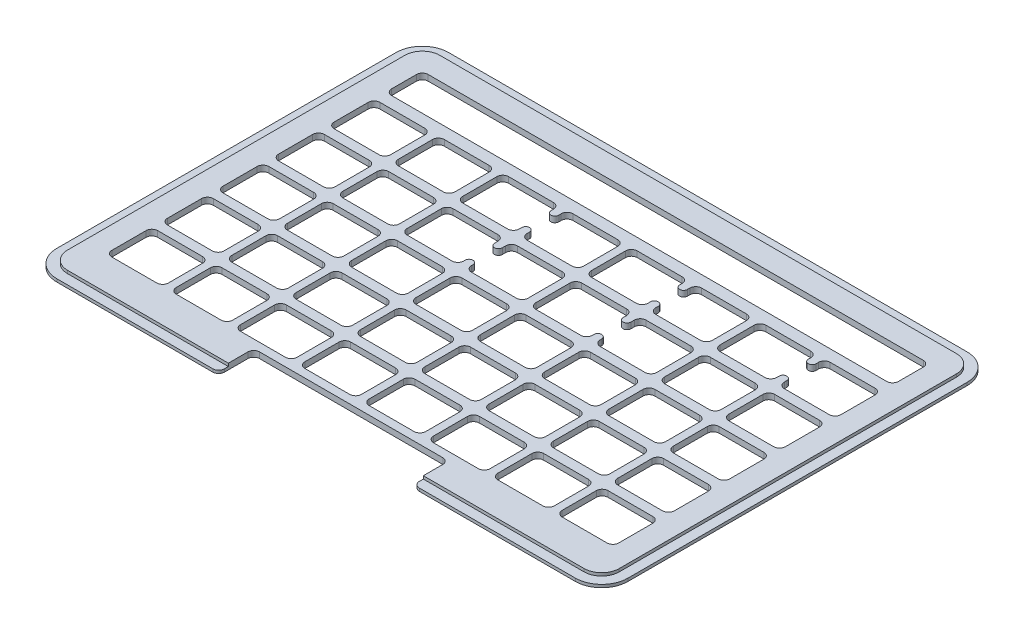
from build123d import *

# Parameters (mm, degrees)
SKETCH1_W                = 293
SKETCH1_H                = 201
OUTER_PROFILE_DEPTH      = 1.5
SKETCH2_W                = 283
SKETCH2_H                = 191
INNER_PROFILE_DEPTH      = 1.5
FILLET1_R                = 9
FILLET2_R                = 13.5
SKETCH3_W                = 29
SKETCH3_H                = 23.5
CUTOUT_DEPTH             = 178.683707751
CORNERS_R                = 3
CUTOUTS_COUNT            = 4
CUTOUTS_PITCH            = 33
CUTOUTS_COUNT_DIR2       = 5
CUTOUTS_PITCH_DIR2       = 28.5
CORNERS_OF_CUTOUTS_R     = 3
MIRROR1_DEPTH            = 3
SKETCH4_W                = 260
SKETCH4_H                = 18.75
MESSAGE_WINDOW_DEPTH     = 178.683707751
MESSAGE_WINDOW_CORNERS_R = 3
CELL_SPLIT_DEPTH         = 178.683707751
CELL_SPLITS_COUNT        = 3
CELL_SPLITS_PITCH        = 66
CELL_SPLITS_COUNT_DIR2   = 2
CELL_SPLITS_PITCH_DIR2   = 29
SKETCH6_W                = 100
SKETCH6_H                = 18
BASE_CUTBACK_DEPTH       = 178.683707751
FILLET5_R                = 3


# Read off the part's stored shape, not the designer's step: Mirror1
with BuildPart() as part:
    # Sketch1 → Outer Profile (new body)
    with BuildSketch(Plane(origin=(0, 0, 0), x_dir=(1, 0, 0), z_dir=(0, 1, 0))):
        Rectangle(SKETCH1_W, SKETCH1_H)
    extrude(amount=OUTER_PROFILE_DEPTH)

    # Sketch2 → Inner Profile (add)
    with BuildSketch(Plane(origin=(0, 1.5, 0), x_dir=(1, 0, 0), z_dir=(0, 1, 0))):
        Rectangle(SKETCH2_W, SKETCH2_H)
    extrude(amount=INNER_PROFILE_DEPTH)

    # Fillet1
    fillet1_edges = [part.edges().sort_by_distance(p)[0] for p in [
        (141.5, 2.25, 95.5),
        (141.5, 2.25, -95.5),
        (-141.5, 2.25, -95.5),
        (-141.5, 2.25, 95.5),
    ]]
    fillet(fillet1_edges, radius=FILLET1_R)

    # Fillet2
    fillet2_edges = [part.edges().sort_by_distance(p)[0] for p in [
        (146.5, 0.75, 100.5),
        (-146.5, 0.75, 100.5),
        (-146.5, 0.75, -100.5),
        (146.5, 0.75, -100.5),
    ]]
    fillet(fillet2_edges, radius=FILLET2_R)

    # Sketch3 → Cutout (cut, through all)
    with BuildSketch(Plane(origin=(0, 3, 0), x_dir=(1, 0, 0), z_dir=(0, 1, 0))):
        with Locations((-16.5, -66.5)):
            Rectangle(SKETCH3_W, SKETCH3_H)
    cutout = extrude(amount=-CUTOUT_DEPTH, mode=Mode.SUBTRACT)

    # Corners
    corners_edges = [part.edges().sort_by_distance(p)[0] for p in [
        (-2, 1.5, 54.75),
        (-2, 1.5, 78.25),
        (-31, 1.5, 78.25),
        (-31, 1.5, 54.75),
    ]]
    fillet(corners_edges, radius=CORNERS_R)

    # Cutouts: Cutout 4 × 5
    with Locations(*[(-i * CUTOUTS_PITCH, 0, -j * CUTOUTS_PITCH_DIR2) for i in range(CUTOUTS_COUNT) for j in range(CUTOUTS_COUNT_DIR2) if (i, j) != (0, 0)]):
        add(cutout, mode=Mode.SUBTRACT)

    # Corners of Cutouts
    corners_of_cutouts_edges = [part.edges().sort_by_distance(p)[0] for p in [
        (-2, 1.5, 26.25),
        (-2, 1.5, 49.75),
        (-31, 1.5, 49.75),
        (-31, 1.5, 26.25),
        (-2, 1.5, -2.25),
        (-2, 1.5, 21.25),
        (-31, 1.5, 21.25),
        (-31, 1.5, -2.25),
        (-2, 1.5, -30.75),
        (-2, 1.5, -7.25),
        (-31, 1.5, -7.25),
        (-31, 1.5, -30.75),
        (-2, 1.5, -59.25),
        (-2, 1.5, -35.75),
        (-31, 1.5, -35.75),
        (-31, 1.5, -59.25),
        (-35, 1.5, 54.75),
        (-35, 1.5, 78.25),
        (-64, 1.5, 78.25),
        (-64, 1.5, 54.75),
        (-35, 1.5, 26.25),
        (-35, 1.5, 49.75),
        (-64, 1.5, 49.75),
        (-64, 1.5, 26.25),
        (-35, 1.5, -2.25),
        (-35, 1.5, 21.25),
        (-64, 1.5, 21.25),
        (-64, 1.5, -2.25),
        (-35, 1.5, -30.75),
        (-35, 1.5, -7.25),
        (-64, 1.5, -7.25),
        (-64, 1.5, -30.75),
        (-35, 1.5, -59.25),
        (-35, 1.5, -35.75),
        (-64, 1.5, -35.75),
        (-64, 1.5, -59.25),
        (-68, 1.5, 54.75),
        (-68, 1.5, 78.25),
        (-97, 1.5, 78.25),
        (-97, 1.5, 54.75),
        (-68, 1.5, 26.25),
        (-68, 1.5, 49.75),
        (-97, 1.5, 49.75),
        (-97, 1.5, 26.25),
        (-68, 1.5, -2.25),
        (-68, 1.5, 21.25),
        (-97, 1.5, 21.25),
        (-97, 1.5, -2.25),
        (-68, 1.5, -30.75),
        (-68, 1.5, -7.25),
        (-97, 1.5, -7.25),
        (-97, 1.5, -30.75),
        (-68, 1.5, -59.25),
        (-68, 1.5, -35.75),
        (-97, 1.5, -35.75),
        (-97, 1.5, -59.25),
        (-101, 1.5, 54.75),
        (-101, 1.5, 78.25),
        (-130, 1.5, 78.25),
        (-130, 1.5, 54.75),
        (-101, 1.5, 26.25),
        (-101, 1.5, 49.75),
        (-130, 1.5, 49.75),
        (-130, 1.5, 26.25),
        (-101, 1.5, -2.25),
        (-101, 1.5, 21.25),
        (-130, 1.5, 21.25),
        (-130, 1.5, -2.25),
        (-101, 1.5, -30.75),
        (-101, 1.5, -7.25),
        (-130, 1.5, -7.25),
        (-130, 1.5, -30.75),
        (-101, 1.5, -59.25),
        (-101, 1.5, -35.75),
        (-130, 1.5, -35.75),
        (-130, 1.5, -59.25),
    ]]
    fillet(corners_of_cutouts_edges, radius=CORNERS_OF_CUTOUTS_R)

    # Mirror1 outline → Mirror1 (cut)
    with BuildSketch(Plane(origin=(0, 0, 0), x_dir=(1, 0, 0), z_dir=(0, 1, 0))):
        with BuildLine():
            Line((5, -78.25), (28, -78.25))
            ThreePointArc((28, -78.25), (30.121320344, -77.371320344), (31, -75.25))
            Line((31, -75.25), (31, -57.75))
            ThreePointArc((31, -57.75), (30.121320344, -55.628679656), (28, -54.75))
            Line((28, -54.75), (5, -54.75))
            ThreePointArc((5, -54.75), (2.878679656, -55.628679656), (2, -57.75))
            Line((2, -57.75), (2, -75.25))
            ThreePointArc((2, -75.25), (2.878679656, -77.371320344), (5, -78.25))
        make_face()
        with BuildLine():
            Line((38, -78.25), (61, -78.25))
            ThreePointArc((61, -78.25), (63.121320344, -77.371320344), (64, -75.25))
            Line((64, -75.25), (64, -57.75))
            ThreePointArc((64, -57.75), (63.121320344, -55.628679656), (61, -54.75))
            Line((61, -54.75), (38, -54.75))
            ThreePointArc((38, -54.75), (35.878679656, -55.628679656), (35, -57.75))
            Line((35, -57.75), (35, -75.25))
            ThreePointArc((35, -75.25), (35.878679656, -77.371320344), (38, -78.25))
        make_face()
        with BuildLine():
            Line((71, -78.25), (94, -78.25))
            ThreePointArc((94, -78.25), (96.121320344, -77.371320344), (97, -75.25))
            Line((97, -75.25), (97, -57.75))
            ThreePointArc((97, -57.75), (96.121320344, -55.628679656), (94, -54.75))
            Line((94, -54.75), (71, -54.75))
            ThreePointArc((71, -54.75), (68.878679656, -55.628679656), (68, -57.75))
            Line((68, -57.75), (68, -75.25))
            ThreePointArc((68, -75.25), (68.878679656, -77.371320344), (71, -78.25))
        make_face()
        with BuildLine():
            Line((104, -78.25), (127, -78.25))
            ThreePointArc((127, -78.25), (129.121320344, -77.371320344), (130, -75.25))
            Line((130, -75.25), (130, -57.75))
            ThreePointArc((130, -57.75), (129.121320344, -55.628679656), (127, -54.75))
            Line((127, -54.75), (104, -54.75))
            ThreePointArc((104, -54.75), (101.878679656, -55.628679656), (101, -57.75))
            Line((101, -57.75), (101, -75.25))
            ThreePointArc((101, -75.25), (101.878679656, -77.371320344), (104, -78.25))
        make_face()
        with BuildLine():
            Line((5, -49.75), (28, -49.75))
            ThreePointArc((28, -49.75), (30.121320344, -48.871320344), (31, -46.75))
            Line((31, -46.75), (31, -29.25))
            ThreePointArc((31, -29.25), (30.121320344, -27.128679656), (28, -26.25))
            Line((28, -26.25), (5, -26.25))
            ThreePointArc((5, -26.25), (2.878679656, -27.128679656), (2, -29.25))
            Line((2, -29.25), (2, -46.75))
            ThreePointArc((2, -46.75), (2.878679656, -48.871320344), (5, -49.75))
        make_face()
        with BuildLine():
            Line((38, -49.75), (61, -49.75))
            ThreePointArc((61, -49.75), (63.121320344, -48.871320344), (64, -46.75))
            Line((64, -46.75), (64, -29.25))
            ThreePointArc((64, -29.25), (63.121320344, -27.128679656), (61, -26.25))
            Line((61, -26.25), (38, -26.25))
            ThreePointArc((38, -26.25), (35.878679656, -27.128679656), (35, -29.25))
            Line((35, -29.25), (35, -46.75))
            ThreePointArc((35, -46.75), (35.878679656, -48.871320344), (38, -49.75))
        make_face()
        with BuildLine():
            Line((71, -49.75), (94, -49.75))
            ThreePointArc((94, -49.75), (96.121320344, -48.871320344), (97, -46.75))
            Line((97, -46.75), (97, -29.25))
            ThreePointArc((97, -29.25), (96.121320344, -27.128679656), (94, -26.25))
            Line((94, -26.25), (71, -26.25))
            ThreePointArc((71, -26.25), (68.878679656, -27.128679656), (68, -29.25))
            Line((68, -29.25), (68, -46.75))
            ThreePointArc((68, -46.75), (68.878679656, -48.871320344), (71, -49.75))
        make_face()
        with BuildLine():
            Line((104, -49.75), (127, -49.75))
            ThreePointArc((127, -49.75), (129.121320344, -48.871320344), (130, -46.75))
            Line((130, -46.75), (130, -29.25))
            ThreePointArc((130, -29.25), (129.121320344, -27.128679656), (127, -26.25))
            Line((127, -26.25), (104, -26.25))
            ThreePointArc((104, -26.25), (101.878679656, -27.128679656), (101, -29.25))
            Line((101, -29.25), (101, -46.75))
            ThreePointArc((101, -46.75), (101.878679656, -48.871320344), (104, -49.75))
        make_face()
        with BuildLine():
            Line((5, -21.25), (28, -21.25))
            ThreePointArc((28, -21.25), (30.121320344, -20.371320344), (31, -18.25))
            Line((31, -18.25), (31, -0.75))
            ThreePointArc((31, -0.75), (30.121320344, 1.371320344), (28, 2.25))
            Line((28, 2.25), (5, 2.25))
            ThreePointArc((5, 2.25), (2.878679656, 1.371320344), (2, -0.75))
            Line((2, -0.75), (2, -18.25))
            ThreePointArc((2, -18.25), (2.878679656, -20.371320344), (5, -21.25))
        make_face()
        with BuildLine():
            Line((38, -21.25), (61, -21.25))
            ThreePointArc((61, -21.25), (63.121320344, -20.371320344), (64, -18.25))
            Line((64, -18.25), (64, -0.75))
            ThreePointArc((64, -0.75), (63.121320344, 1.371320344), (61, 2.25))
            Line((61, 2.25), (38, 2.25))
            ThreePointArc((38, 2.25), (35.878679656, 1.371320344), (35, -0.75))
            Line((35, -0.75), (35, -18.25))
            ThreePointArc((35, -18.25), (35.878679656, -20.371320344), (38, -21.25))
        make_face()
        with BuildLine():
            Line((71, -21.25), (94, -21.25))
            ThreePointArc((94, -21.25), (96.121320344, -20.371320344), (97, -18.25))
            Line((97, -18.25), (97, -0.75))
            ThreePointArc((97, -0.75), (96.121320344, 1.371320344), (94, 2.25))
            Line((94, 2.25), (71, 2.25))
            ThreePointArc((71, 2.25), (68.878679656, 1.371320344), (68, -0.75))
            Line((68, -0.75), (68, -18.25))
            ThreePointArc((68, -18.25), (68.878679656, -20.371320344), (71, -21.25))
        make_face()
        with BuildLine():
            Line((104, -21.25), (127, -21.25))
            ThreePointArc((127, -21.25), (129.121320344, -20.371320344), (130, -18.25))
            Line((130, -18.25), (130, -0.75))
            ThreePointArc((130, -0.75), (129.121320344, 1.371320344), (127, 2.25))
            Line((127, 2.25), (104, 2.25))
            ThreePointArc((104, 2.25), (101.878679656, 1.371320344), (101, -0.75))
            Line((101, -0.75), (101, -18.25))
            ThreePointArc((101, -18.25), (101.878679656, -20.371320344), (104, -21.25))
        make_face()
        with BuildLine():
            Line((5, 7.25), (28, 7.25))
            ThreePointArc((28, 7.25), (30.121320344, 8.128679656), (31, 10.25))
            Line((31, 10.25), (31, 27.75))
            ThreePointArc((31, 27.75), (30.121320344, 29.871320344), (28, 30.75))
            Line((28, 30.75), (5, 30.75))
            ThreePointArc((5, 30.75), (2.878679656, 29.871320344), (2, 27.75))
            Line((2, 27.75), (2, 10.25))
            ThreePointArc((2, 10.25), (2.878679656, 8.128679656), (5, 7.25))
        make_face()
        with BuildLine():
            Line((38, 7.25), (61, 7.25))
            ThreePointArc((61, 7.25), (63.121320344, 8.128679656), (64, 10.25))
            Line((64, 10.25), (64, 27.75))
            ThreePointArc((64, 27.75), (63.121320344, 29.871320344), (61, 30.75))
            Line((61, 30.75), (38, 30.75))
            ThreePointArc((38, 30.75), (35.878679656, 29.871320344), (35, 27.75))
            Line((35, 27.75), (35, 10.25))
            ThreePointArc((35, 10.25), (35.878679656, 8.128679656), (38, 7.25))
        make_face()
        with BuildLine():
            Line((71, 7.25), (94, 7.25))
            ThreePointArc((94, 7.25), (96.121320344, 8.128679656), (97, 10.25))
            Line((97, 10.25), (97, 27.75))
            ThreePointArc((97, 27.75), (96.121320344, 29.871320344), (94, 30.75))
            Line((94, 30.75), (71, 30.75))
            ThreePointArc((71, 30.75), (68.878679656, 29.871320344), (68, 27.75))
            Line((68, 27.75), (68, 10.25))
            ThreePointArc((68, 10.25), (68.878679656, 8.128679656), (71, 7.25))
        make_face()
        with BuildLine():
            Line((104, 7.25), (127, 7.25))
            ThreePointArc((127, 7.25), (129.121320344, 8.128679656), (130, 10.25))
            Line((130, 10.25), (130, 27.75))
            ThreePointArc((130, 27.75), (129.121320344, 29.871320344), (127, 30.75))
            Line((127, 30.75), (104, 30.75))
            ThreePointArc((104, 30.75), (101.878679656, 29.871320344), (101, 27.75))
            Line((101, 27.75), (101, 10.25))
            ThreePointArc((101, 10.25), (101.878679656, 8.128679656), (104, 7.25))
        make_face()
        with BuildLine():
            Line((5, 35.75), (28, 35.75))
            ThreePointArc((28, 35.75), (30.121320344, 36.628679656), (31, 38.75))
            Line((31, 38.75), (31, 56.25))
            ThreePointArc((31, 56.25), (30.121320344, 58.371320344), (28, 59.25))
            Line((28, 59.25), (5, 59.25))
            ThreePointArc((5, 59.25), (2.878679656, 58.371320344), (2, 56.25))
            Line((2, 56.25), (2, 38.75))
            ThreePointArc((2, 38.75), (2.878679656, 36.628679656), (5, 35.75))
        make_face()
        with BuildLine():
            Line((38, 35.75), (61, 35.75))
            ThreePointArc((61, 35.75), (63.121320344, 36.628679656), (64, 38.75))
            Line((64, 38.75), (64, 56.25))
            ThreePointArc((64, 56.25), (63.121320344, 58.371320344), (61, 59.25))
            Line((61, 59.25), (38, 59.25))
            ThreePointArc((38, 59.25), (35.878679656, 58.371320344), (35, 56.25))
            Line((35, 56.25), (35, 38.75))
            ThreePointArc((35, 38.75), (35.878679656, 36.628679656), (38, 35.75))
        make_face()
        with BuildLine():
            Line((71, 35.75), (94, 35.75))
            ThreePointArc((94, 35.75), (96.121320344, 36.628679656), (97, 38.75))
            Line((97, 38.75), (97, 56.25))
            ThreePointArc((97, 56.25), (96.121320344, 58.371320344), (94, 59.25))
            Line((94, 59.25), (71, 59.25))
            ThreePointArc((71, 59.25), (68.878679656, 58.371320344), (68, 56.25))
            Line((68, 56.25), (68, 38.75))
            ThreePointArc((68, 38.75), (68.878679656, 36.628679656), (71, 35.75))
        make_face()
        with BuildLine():
            Line((104, 35.75), (127, 35.75))
            ThreePointArc((127, 35.75), (129.121320344, 36.628679656), (130, 38.75))
            Line((130, 38.75), (130, 56.25))
            ThreePointArc((130, 56.25), (129.121320344, 58.371320344), (127, 59.25))
            Line((127, 59.25), (104, 59.25))
            ThreePointArc((104, 59.25), (101.878679656, 58.371320344), (101, 56.25))
            Line((101, 56.25), (101, 38.75))
            ThreePointArc((101, 38.75), (101.878679656, 36.628679656), (104, 35.75))
        make_face()
    extrude(amount=MIRROR1_DEPTH, mode=Mode.SUBTRACT)

    # Sketch4 → Message Window (cut, through all)
    with BuildSketch(Plane(origin=(0, 3, 0), x_dir=(1, 0, 0), z_dir=(0, 1, 0))):
        with Locations((0, 74.625)):
            Rectangle(SKETCH4_W, SKETCH4_H)
    extrude(amount=-MESSAGE_WINDOW_DEPTH, mode=Mode.SUBTRACT)

    # Message Window Corners
    message_window_corners_edges = [part.edges().sort_by_distance(p)[0] for p in [
        (-130, 1.5, -65.25),
        (-130, 1.5, -84),
        (130, 1.5, -84),
        (130, 1.5, -65.25),
    ]]
    fillet(message_window_corners_edges, radius=MESSAGE_WINDOW_CORNERS_R)

    # Sketch5 → Cell Split (cut, through all)
    with BuildSketch(Plane(origin=(0, 3, 0), x_dir=(1, 0, 0), z_dir=(0, 1, 0))):
        with BuildLine():
            Line((-35, 55), (-35, 40))
            ThreePointArc((-35, 40), (-33, 42), (-31, 40))
            Line((-31, 40), (-31, 55))
            ThreePointArc((-31, 55), (-33, 53), (-35, 55))
        make_face()
    cell_split = extrude(amount=-CELL_SPLIT_DEPTH, mode=Mode.SUBTRACT)

    # Cell Splits: Cell Split 3 × 2, 1 skipped
    with Locations(*[(i * CELL_SPLITS_PITCH, 0, j * CELL_SPLITS_PITCH_DIR2) for i in range(CELL_SPLITS_COUNT) for j in range(CELL_SPLITS_COUNT_DIR2) if (i, j) not in ((0, 0), (2, 1))]):
        add(cell_split, mode=Mode.SUBTRACT)

    # Sketch6 → Base Cutback (cut, through all)
    with BuildSketch(Plane(origin=(0, 3, 0), x_dir=(1, 0, 0), z_dir=(0, 1, 0))):
        with Locations((0, -91.5)):
            Rectangle(SKETCH6_W, SKETCH6_H)
    extrude(amount=-BASE_CUTBACK_DEPTH, mode=Mode.SUBTRACT)

    # Fillet5
    fillet5_edges = [part.edges().sort_by_distance(p)[0] for p in [
        (50, 0.75, 100.5),
        (50, 1.5, 82.5),
        (-50, 0.75, 100.5),
        (-50, 1.5, 82.5),
    ]]
    fillet(fillet5_edges, radius=FILLET5_R)


solid = part.part
